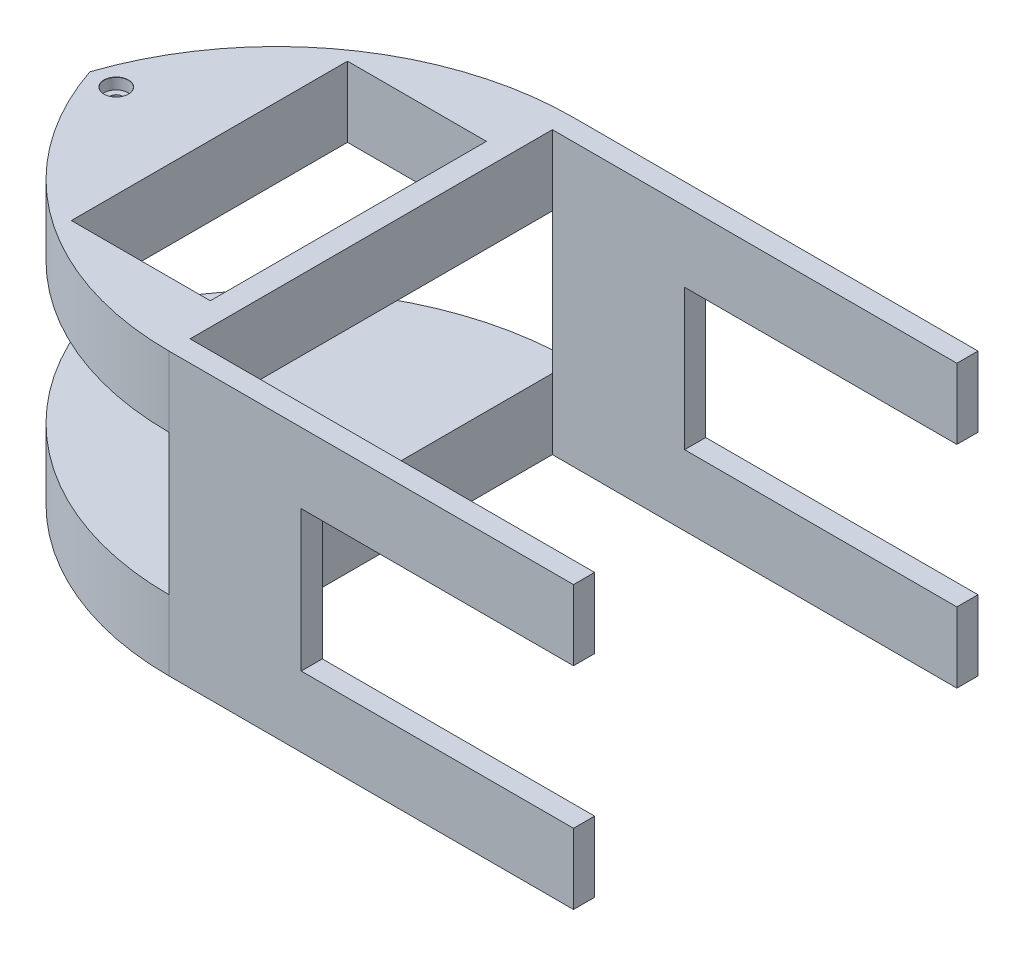
from build123d import *

# Parameters (mm, degrees)
SKETCH1_W           = 20.32
SKETCH1_H           = 10.16
BOSS_EXTRUDE1_DEPTH = 29.21
SKETCH1_4_W         = 40.64
SKETCH1_4_H         = 10.16
BOSS_EXTRUDE2_DEPTH = 29.21
SKETCH5_W           = 3.048
SKETCH5_H           = 40.64
BOSS_EXTRUDE4_DEPTH = 58.42
SKETCH10_W          = 39.323622634
SKETCH10_H          = 20.32
CUT_EXTRUDE2_DEPTH  = 101.12884899
CUT_EXTRUDE4_DEPTH  = 58.42
CUT_EXTRUDE5_REACH  = 95.3
SKETCH13_W          = 20.066
SKETCH13_H          = 39.878


with BuildPart() as part:
    # Sketch1 → Boss-Extrude1 (new, symmetric)
    with BuildSketch(Plane.XY):
        with Locations((-10.16, 15.24)):
            Rectangle(SKETCH1_W, SKETCH1_H)
    boss_extrude1 = extrude(amount=BOSS_EXTRUDE1_DEPTH, both=True)

    # Mirror1: Boss-Extrude1 across plane
    add(boss_extrude1.mirror(Plane(origin=(0, 0, 0), x_dir=(0, 0, 1), z_dir=(1, 0, 0))))



with BuildPart() as body_2:
    # Sketch1<4> → Boss-Extrude2 (new, symmetric)
    with BuildSketch(Plane.XY):
        with Locations((0, -15.24)):
            Rectangle(SKETCH1_4_W, SKETCH1_4_H)
    extrude(amount=BOSS_EXTRUDE2_DEPTH, both=True)


with BuildPart() as part_1:
    add(part.part)

    add(body_2.part)  # Boss-Extrude4 merges body 2
    # Sketch5 → Boss-Extrude4 (add)
    with BuildSketch(Plane(origin=(20.32, 0, 0), x_dir=(0, 0, -1), z_dir=(1, 0, 0))):
        with Locations((-27.686, 0)):
            Rectangle(SKETCH5_W, SKETCH5_H)
        with Locations((27.686, 0)):
            Rectangle(SKETCH5_W, SKETCH5_H)
    extrude(amount=BOSS_EXTRUDE4_DEPTH)

    # Sketch8 → CBORE for M1.6 SHCS1 (revolve, cut)
    with BuildSketch(Plane(origin=(-16.51, 20.32, 0), x_dir=(0, 0, 1), z_dir=(1, 0, 0))):
        Polygon((0, 0), (0, 40.64), (0.9, 40.64), (0.9, 1.6), (1.75, 1.6), (1.75, 0.025), (1.775, 0), align=None)
    revolve(axis=Axis((-16.51, 26.67, 0), (0, -1, 0)), mode=Mode.SUBTRACT)

    # Sketch10 → Cut-Extrude2 (cut, through all)
    with BuildSketch(Plane.XY.offset(29.21)):
        with Locations((59.078188683, 0)):
            Rectangle(SKETCH10_W, SKETCH10_H)
    extrude(amount=-CUT_EXTRUDE2_DEPTH, mode=Mode.SUBTRACT)

    # Sketch12 → Cut-Extrude4 (cut)
    with BuildSketch(Plane(origin=(0, 20.32, 0), x_dir=(1, 0, 0), z_dir=(0, 1, 0))):
        with BuildLine():
            Line((-20.32, 29.21), (-20.32, 0))
            ThreePointArc((-20.32, 0), (-4.704156829, 21.149913849), (20.32, 29.21))
            Line((20.32, 29.21), (-20.32, 29.21))
        make_face()
        with BuildLine():
            Line((-20.32, 0), (-20.32, -29.21))
            Line((-20.32, -29.21), (20.32, -29.21))
            ThreePointArc((20.32, -29.21), (-4.704156829, -21.149913849), (-20.32, 0))
        make_face()
    extrude(amount=-CUT_EXTRUDE4_DEPTH, mode=Mode.SUBTRACT)

    # Sketch13 → Cut-Extrude5 (cut, up to next)
    with BuildSketch(Plane(origin=(0, 20.32, 0), x_dir=(1, 0, 0), z_dir=(0, 1, 0)), mode=Mode.PRIVATE) as cut_extrude5_sk1:
        with Locations((6.985, 0)):
            Rectangle(SKETCH13_W, SKETCH13_H)
    cut_extrude5_tool1 = extrude(cut_extrude5_sk1.sketch, amount=-CUT_EXTRUDE5_REACH, mode=Mode.PRIVATE) & part_1.part
    add(cut_extrude5_tool1.solids().sort_by_distance((6.985, 20.32, 0))[0], mode=Mode.SUBTRACT)


solid = part_1.part
